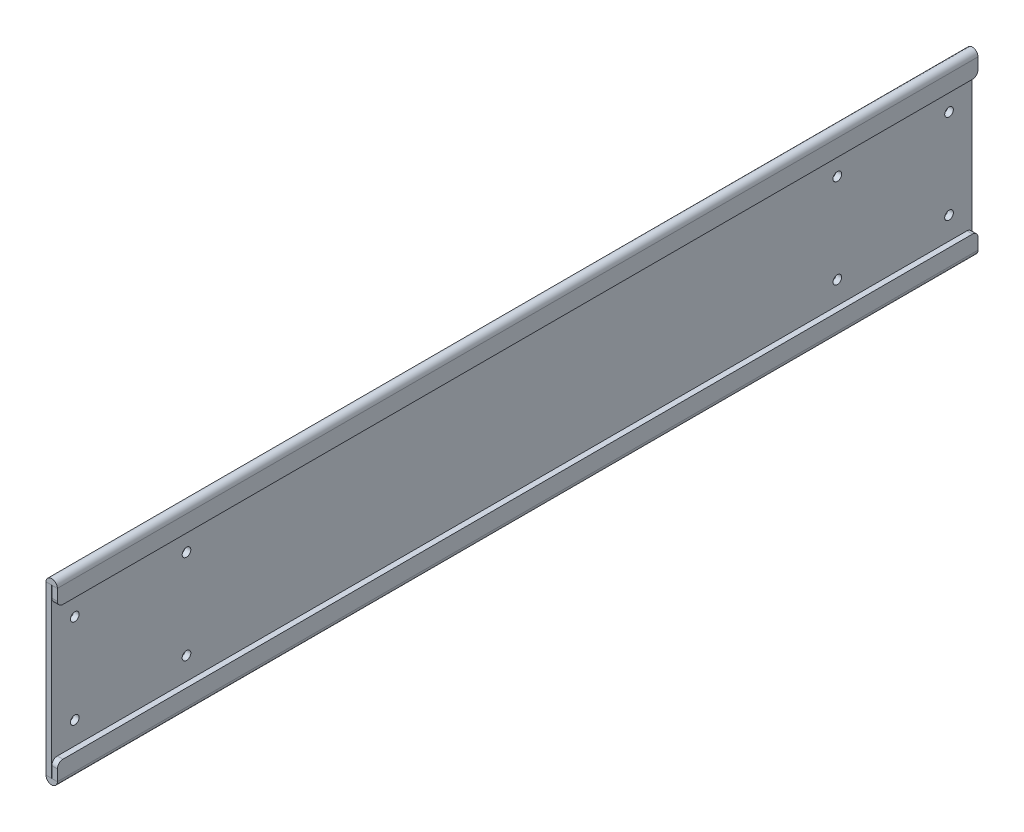
from build123d import *

# Parameters (mm, degrees)
SKETCH1_W          = 523.3416
SKETCH1_H          = 101.6
SKETCH1_R          = 2.45745
BASE_FLANGE1_DEPTH = 3.175
HEM1_DEPTH         = 523.3416
HEM1_2_DEPTH       = 523.3416
FILLET1_R          = 3.175


# Read off the part's stored shape, not the designer's step: Hem1
# Sheet-metal steps are written as plain solids
with BuildPart() as part:
    # Sketch1 → Base-Flange1 (new body)
    with BuildSketch(Plane(origin=(0, 0, 0), x_dir=(0, 0, -1), z_dir=(1, 0, 0))):
        with Locations((-261.6708, 50.8)):
            Rectangle(SKETCH1_W, SKETCH1_H)
        with Locations((-510.15011, 76.2)):
            Circle(SKETCH1_R, mode=Mode.SUBTRACT)
        with Locations((-446.65011, 76.2)):
            Circle(SKETCH1_R, mode=Mode.SUBTRACT)
        with Locations((-446.65011, 25.4)):
            Circle(SKETCH1_R, mode=Mode.SUBTRACT)
        with Locations((-510.15011, 25.4)):
            Circle(SKETCH1_R, mode=Mode.SUBTRACT)
        with Locations(Location((-76.69149, 76.2, 0), (0, 0, 180))):
            Circle(SKETCH1_R, mode=Mode.SUBTRACT)
        with Locations(Location((-76.69149, 25.4, 0), (0, 0, 180))):
            Circle(SKETCH1_R, mode=Mode.SUBTRACT)
        with Locations(Location((-13.19149, 25.4, 0), (0, 0, 180))):
            Circle(SKETCH1_R, mode=Mode.SUBTRACT)
        with Locations(Location((-13.19149, 76.2, 0), (0, 0, 180))):
            Circle(SKETCH1_R, mode=Mode.SUBTRACT)
    extrude(amount=-BASE_FLANGE1_DEPTH)

    # Hem1 outline → Hem1 (cut)
    with BuildSketch(Plane.XY):
        with BuildLine():
            ThreePointArc((-3.175, 98.375), (-2.248029047, 100.637672645), (0, 101.59961238))
            Line((0, 101.59961238), (0, 101.6))
            Line((0, 101.6), (-3.175, 101.6))
            Line((-3.175, 101.6), (-3.175, 98.375))
        make_face()
        with BuildLine():
            ThreePointArc((0, 0.00038762), (-2.248029047, 0.962327355), (-3.175, 3.225))
            Line((-3.175, 3.225), (-3.175, 0))
            Line((-3.175, 0), (0, 0))
            Line((0, 0), (0, 0.00038762))
        make_face()
    extrude(amount=HEM1_DEPTH, mode=Mode.SUBTRACT)

    # Hem1 2 outline → Hem1 2 (add)
    with BuildSketch(Plane.XY):
        with BuildLine():
            Line((0.1, 88.9), (3.275, 88.9))
            Line((3.275, 88.9), (3.275, 98.375))
            ThreePointArc((3.275, 98.375), (2.312672645, 100.673029047), (0, 101.59961238))
            Line((0, 101.59961238), (0, 98.375))
            ThreePointArc((0, 98.375), (0.05, 98.425), (0.1, 98.375))
            Line((0.1, 98.375), (0.1, 88.9))
        make_face()
        with BuildLine():
            ThreePointArc((0.1, 3.225), (0.05, 3.175), (0, 3.225))
            Line((0, 3.225), (0, 0.00038762))
            ThreePointArc((0, 0.00038762), (2.312672645, 0.926970953), (3.275, 3.225))
            Line((3.275, 3.225), (3.275, 12.7))
            Line((3.275, 12.7), (0.1, 12.7))
            Line((0.1, 12.7), (0.1, 3.225))
        make_face()
    extrude(amount=HEM1_2_DEPTH)

    # Fillet1
    fillet1_edges = [part.edges().sort_by_distance(p)[0] for p in [
        (1.6875, 88.9, 523.3416),
        (1.6875, 88.9, 0),
        (1.6875, 12.7, 0),
        (1.6875, 12.7, 523.3416),
    ]]
    fillet(fillet1_edges, radius=FILLET1_R)


solid = part.part
